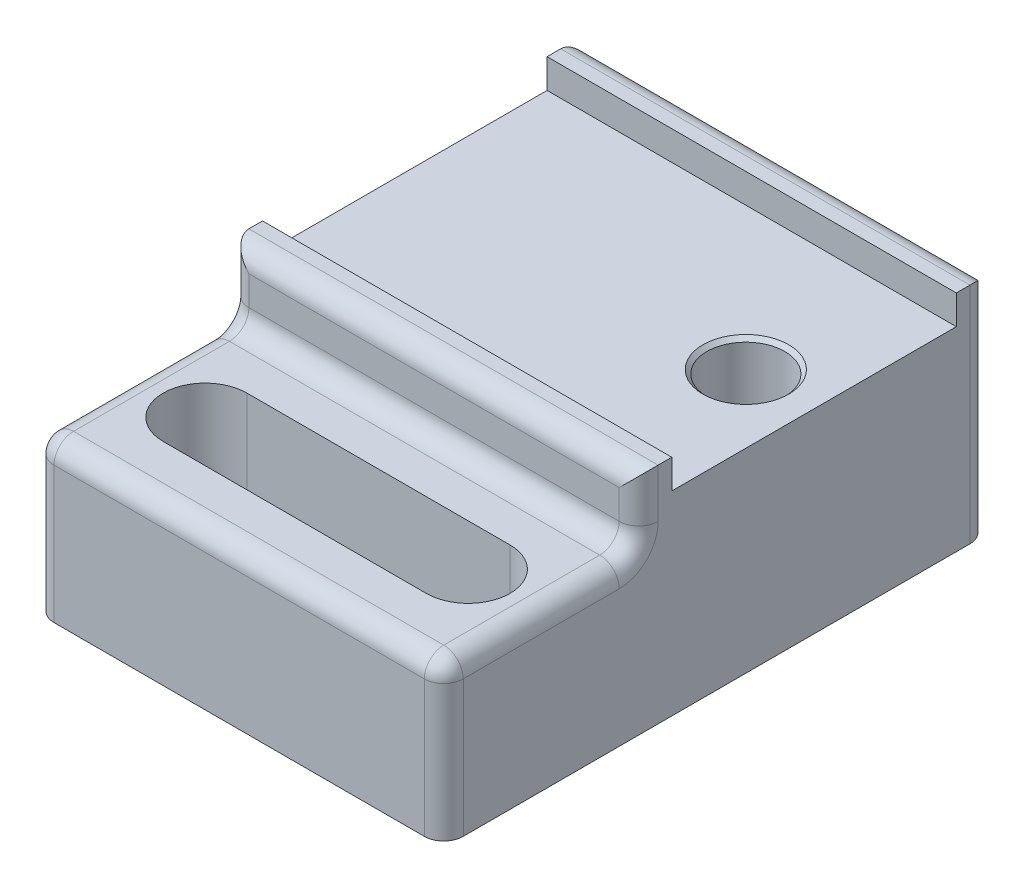
from build123d import *

# Parameters (mm, degrees)
SKETCH1_W           = 21
SKETCH1_H           = 14.6
BOSS_EXTRUDE1_DEPTH = 10
SKETCH1_3_W         = 21
SKETCH1_3_H         = 1.7
BOSS_EXTRUDE2_DEPTH = 11.5
SKETCH3_W           = 21
SKETCH3_H           = 10
BOSS_EXTRUDE4_DEPTH = 8
FILLET1_R           = 1
CUT_EXTRUDE1_DEPTH  = 24.135470603
SKETCH5_R           = 2
CUT_EXTRUDE2_DEPTH  = 6.8
CHAMFER1_SIZE       = 0.2


with BuildPart() as part:
    # Sketch1 → Boss-Extrude1 (new body)
    with BuildSketch(Plane(origin=(0, 0, 0), x_dir=(1, 0, 0), z_dir=(0, 1, 0))):
        Rectangle(SKETCH1_W, SKETCH1_H)
    extrude(amount=BOSS_EXTRUDE1_DEPTH)

    # Sketch1<3> → Boss-Extrude2 (add)
    with BuildSketch(Plane(origin=(0, 0, 0), x_dir=(1, 0, 0), z_dir=(0, 1, 0))):
        with Locations((0, 8.15)):
            Rectangle(SKETCH1_3_W, SKETCH1_3_H)
        with Locations((0, -8.15)):
            Rectangle(SKETCH1_3_W, SKETCH1_3_H)
    extrude(amount=BOSS_EXTRUDE2_DEPTH)

    # Sketch3 → Boss-Extrude4 (add)
    with BuildSketch(Plane(origin=(0, 0, 0), x_dir=(1, 0, 0), z_dir=(0, 1, 0))):
        with Locations((0, -14)):
            Rectangle(SKETCH3_W, SKETCH3_H)
    extrude(amount=BOSS_EXTRUDE4_DEPTH)

    # Fillet1
    fillet1_edges = [part.edges().sort_by_distance(p)[0] for p in [
        (10.5, 8, 14),
        (-10.5, 9.75, 9),
        (10.5, 5.75, -9),
        (0, 11.5, 9),
        (-10.5, 5.75, -9),
        (0, 11.5, -9),
        (-10.5, 4, 19),
        (10.5, 4, 19),
        (0, 8, 19),
        (10.5, 9.75, 9),
        (-10.5, 8, 14),
        (0, 8, 9),
    ]]
    fillet(fillet1_edges, radius=FILLET1_R)

    # Sketch4 → Cut-Extrude1 (cut, through all)
    with BuildSketch(Plane(origin=(0, 8, 0), x_dir=(1, 0, 0), z_dir=(0, 1, 0))):
        with BuildLine():
            Line((-6.75, -11.85), (6.75, -11.85))
            ThreePointArc((6.75, -11.85), (8.9, -14), (6.75, -16.15))
            Line((6.75, -16.15), (-6.75, -16.15))
            ThreePointArc((-6.75, -16.15), (-8.9, -14), (-6.75, -11.85))
        make_face()
    extrude(amount=-CUT_EXTRUDE1_DEPTH, mode=Mode.SUBTRACT)

    # Sketch5 → Cut-Extrude2 (cut)
    with BuildSketch(Plane(origin=(0, 10, 0), x_dir=(1, 0, 0), z_dir=(0, 1, 0))):
        with Locations((7, 0)):
            Circle(SKETCH5_R)
    extrude(amount=-CUT_EXTRUDE2_DEPTH, mode=Mode.SUBTRACT)

    # Chamfer1
    chamfer1_edges = [part.edges().sort_by_distance(p)[0] for p in [
        (5, 10, 0),
    ]]
    chamfer(chamfer1_edges, length=CHAMFER1_SIZE)


solid = part.part
